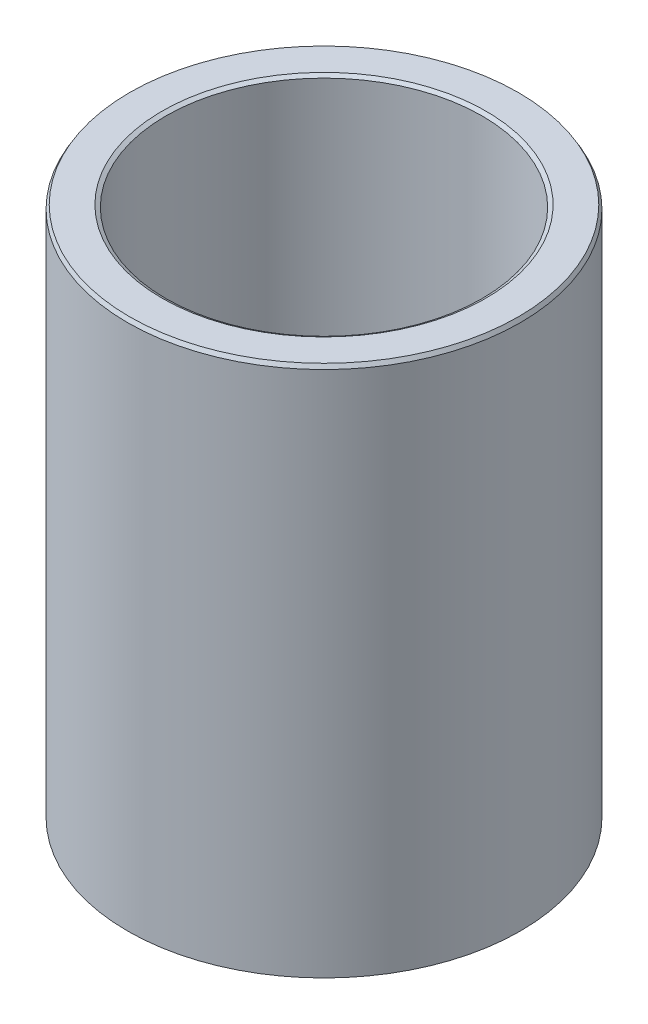
from build123d import *
from OCP.BRepFilletAPI import BRepFilletAPI_MakeChamfer

# Parameters (mm, degrees)
SKETCH1_R           = 15
BOSS_EXTRUDE1_DEPTH = 40.677645403
SKETCH2_R           = 12.07095275
CUT_EXTRUDE1_DEPTH  = 46.876691637
CHAMFER1_SIZE       = 0.29430595
CHAMFER1_SIZE2      = 0.169917619


with BuildPart() as part:
    # Sketch1 → Boss-Extrude1 (new body)
    with BuildSketch(Plane(origin=(0, 0, 0), x_dir=(1, 0, 0), z_dir=(0, 1, 0))):
        Circle(SKETCH1_R)
    extrude(amount=BOSS_EXTRUDE1_DEPTH)

    # Sketch2 → Cut-Extrude1 (cut, through all)
    with BuildSketch(Plane(origin=(0, 0, 0), x_dir=(1, 0, 0), z_dir=(0, 1, 0))):
        Circle(SKETCH2_R)
    extrude(amount=CUT_EXTRUDE1_DEPTH, mode=Mode.SUBTRACT)

    # Chamfer1: one chamfer whose edges measure the first distance from different faces: ONE call of the kernel's chamfer builder (chamfer() names one face for all edges)
    chamfer1_edges_1 = [part.edges().sort_by_distance(p)[0] for p in [
        (-12.07095275, 40.677645403, 0),
    ]]
    chamfer1_side_1 = [part.faces().sort_by_distance(p)[0] for p in [
        (-14.575735931, 40.677645403, 0),
    ]]
    chamfer1_edges_2 = [part.edges().sort_by_distance(p)[0] for p in [
        (-12.07095275, 0, 0),
    ]]
    chamfer1_side_2 = [part.faces().sort_by_distance(p)[0] for p in [
        (-12.07095275, 20.338822702, 0),
    ]]
    chamfer1_edges_3 = [part.edges().sort_by_distance(p)[0] for p in [
        (-15, 0, 0),
    ]]
    chamfer1_side_3 = [part.faces().sort_by_distance(p)[0] for p in [
        (-14.575735931, 0, 0),
    ]]
    chamfer1_edges_4 = [part.edges().sort_by_distance(p)[0] for p in [
        (-15, 40.677645403, 0),
    ]]
    chamfer1_side_4 = [part.faces().sort_by_distance(p)[0] for p in [
        (-15, 20.338822702, 0),
    ]]
    chamfer1 = BRepFilletAPI_MakeChamfer(part.part.solid().wrapped)
    for e in chamfer1_edges_1:
        chamfer1.Add(CHAMFER1_SIZE, CHAMFER1_SIZE2, e.wrapped, chamfer1_side_1[0].wrapped)  # the first distance lies on this face
    for e in chamfer1_edges_2:
        chamfer1.Add(CHAMFER1_SIZE, CHAMFER1_SIZE2, e.wrapped, chamfer1_side_2[0].wrapped)  # the first distance lies on this face
    for e in chamfer1_edges_3:
        chamfer1.Add(CHAMFER1_SIZE, CHAMFER1_SIZE2, e.wrapped, chamfer1_side_3[0].wrapped)  # the first distance lies on this face
    for e in chamfer1_edges_4:
        chamfer1.Add(CHAMFER1_SIZE, CHAMFER1_SIZE2, e.wrapped, chamfer1_side_4[0].wrapped)  # the first distance lies on this face
    add(Compound.cast(chamfer1.Shape()), mode=Mode.REPLACE)


solid = part.part
